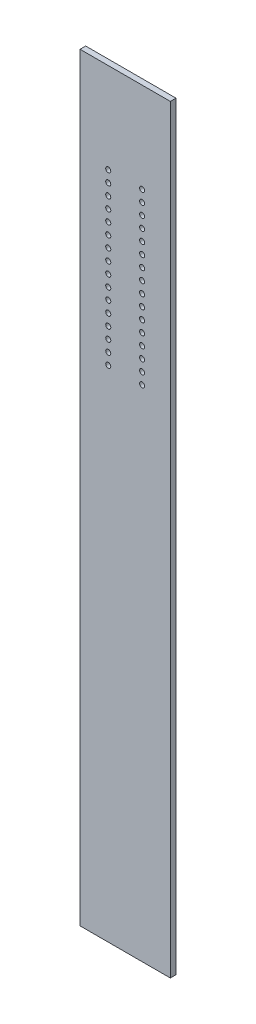
from build123d import *

# Parameters (mm, degrees)
SKETCH1_W           = 50.8
SKETCH1_H           = 3.175
BOSS_EXTRUDE1_DEPTH = 427.1518
SKETCH4_R           = 1.4224
CUT_EXTRUDE2_DEPTH  = 2.54
SKETCH5_W           = 12.58267919
SKETCH5_H           = 101.029760921
BOSS_EXTRUDE2_DEPTH = 2.54
SKETCH6_W           = 7.546607927
SKETCH6_H           = 108.671154153
SKETCH6_W_2         = 9.055929513
BOSS_EXTRUDE3_DEPTH = 2.54


with BuildPart() as part:
    # Sketch1 → Boss-Extrude1 (new body)
    with BuildSketch(Plane(origin=(0, 0, 0), x_dir=(1, 0, 0), z_dir=(0, 1, 0))):
        with Locations((0, 70.254548969)):
            Rectangle(SKETCH1_W, SKETCH1_H)
    extrude(amount=BOSS_EXTRUDE1_DEPTH)

    # Sketch4 → Cut-Extrude2 (cut)
    with BuildSketch(Plane.XY.offset(-68.667048969)):
        with Locations((-3.175, 376.3518)):
            Circle(SKETCH4_R)
        with Locations((-9.525, 376.3518)):
            Circle(SKETCH4_R)
        with Locations((-15.875, 376.3518)):
            Circle(SKETCH4_R)
        with Locations((-9.525, 370.0018)):
            Circle(SKETCH4_R)
        with Locations((-15.875, 370.0018)):
            Circle(SKETCH4_R)
        with Locations((-9.525, 363.6518)):
            Circle(SKETCH4_R)
        with Locations((-15.875, 363.6518)):
            Circle(SKETCH4_R)
        with Locations((-9.525, 357.3018)):
            Circle(SKETCH4_R)
        with Locations((-15.875, 357.3018)):
            Circle(SKETCH4_R)
        with Locations((-9.525, 350.9518)):
            Circle(SKETCH4_R)
        with Locations((-15.875, 350.9518)):
            Circle(SKETCH4_R)
        with Locations((-9.525, 344.6018)):
            Circle(SKETCH4_R)
        with Locations((-15.875, 344.6018)):
            Circle(SKETCH4_R)
        with Locations((-9.525, 338.2518)):
            Circle(SKETCH4_R)
        with Locations((-15.875, 338.2518)):
            Circle(SKETCH4_R)
        with Locations((-9.525, 331.9018)):
            Circle(SKETCH4_R)
        with Locations((-15.875, 331.9018)):
            Circle(SKETCH4_R)
        with Locations((-9.525, 325.5518)):
            Circle(SKETCH4_R)
        with Locations((-15.875, 325.5518)):
            Circle(SKETCH4_R)
        with Locations((-9.525, 319.2018)):
            Circle(SKETCH4_R)
        with Locations((-15.875, 319.2018)):
            Circle(SKETCH4_R)
        with Locations((-9.525, 312.8518)):
            Circle(SKETCH4_R)
        with Locations((-15.875, 312.8518)):
            Circle(SKETCH4_R)
        with Locations((-9.525, 306.5018)):
            Circle(SKETCH4_R)
        with Locations((-15.875, 306.5018)):
            Circle(SKETCH4_R)
        with Locations((-9.525, 300.1518)):
            Circle(SKETCH4_R)
        with Locations((-15.875, 300.1518)):
            Circle(SKETCH4_R)
        with Locations((-9.525, 293.8018)):
            Circle(SKETCH4_R)
        with Locations((-15.875, 293.8018)):
            Circle(SKETCH4_R)
        with Locations((-9.525, 287.4518)):
            Circle(SKETCH4_R)
        with Locations((-15.875, 287.4518)):
            Circle(SKETCH4_R)
        with Locations((-9.525, 281.1018)):
            Circle(SKETCH4_R)
        with Locations((-15.875, 281.1018)):
            Circle(SKETCH4_R)
        with Locations((-3.175, 370.0018)):
            Circle(SKETCH4_R)
        with Locations((-3.175, 363.6518)):
            Circle(SKETCH4_R)
        with Locations((-3.175, 357.3018)):
            Circle(SKETCH4_R)
        with Locations((-3.175, 350.9518)):
            Circle(SKETCH4_R)
        with Locations((-3.175, 344.6018)):
            Circle(SKETCH4_R)
        with Locations((-3.175, 338.2518)):
            Circle(SKETCH4_R)
        with Locations((-3.175, 331.9018)):
            Circle(SKETCH4_R)
        with Locations((-3.175, 325.5518)):
            Circle(SKETCH4_R)
        with Locations((-3.175, 319.2018)):
            Circle(SKETCH4_R)
        with Locations((-3.175, 312.8518)):
            Circle(SKETCH4_R)
        with Locations((-3.175, 306.5018)):
            Circle(SKETCH4_R)
        with Locations((-3.175, 300.1518)):
            Circle(SKETCH4_R)
        with Locations((-3.175, 293.8018)):
            Circle(SKETCH4_R)
        with Locations((-3.175, 287.4518)):
            Circle(SKETCH4_R)
        with Locations((-3.175, 281.1018)):
            Circle(SKETCH4_R)
        with Locations((3.175, 281.1018)):
            Circle(SKETCH4_R)
        with Locations((3.175, 287.4518)):
            Circle(SKETCH4_R)
        with Locations((3.175, 293.8018)):
            Circle(SKETCH4_R)
        with Locations((3.175, 300.1518)):
            Circle(SKETCH4_R)
        with Locations((3.175, 306.5018)):
            Circle(SKETCH4_R)
        with Locations((3.175, 312.8518)):
            Circle(SKETCH4_R)
        with Locations((3.175, 319.2018)):
            Circle(SKETCH4_R)
        with Locations((3.175, 325.5518)):
            Circle(SKETCH4_R)
        with Locations((3.175, 331.9018)):
            Circle(SKETCH4_R)
        with Locations((3.175, 338.2518)):
            Circle(SKETCH4_R)
        with Locations((3.175, 344.6018)):
            Circle(SKETCH4_R)
        with Locations((3.175, 350.9518)):
            Circle(SKETCH4_R)
        with Locations((3.175, 357.3018)):
            Circle(SKETCH4_R)
        with Locations((3.175, 363.6518)):
            Circle(SKETCH4_R)
        with Locations((3.175, 370.0018)):
            Circle(SKETCH4_R)
        with Locations((15.875, 281.1018)):
            Circle(SKETCH4_R)
        with Locations((9.525, 281.1018)):
            Circle(SKETCH4_R)
        with Locations((15.875, 287.4518)):
            Circle(SKETCH4_R)
        with Locations((9.525, 287.4518)):
            Circle(SKETCH4_R)
        with Locations((15.875, 293.8018)):
            Circle(SKETCH4_R)
        with Locations((9.525, 293.8018)):
            Circle(SKETCH4_R)
        with Locations((15.875, 300.1518)):
            Circle(SKETCH4_R)
        with Locations((9.525, 300.1518)):
            Circle(SKETCH4_R)
        with Locations((15.875, 306.5018)):
            Circle(SKETCH4_R)
        with Locations((9.525, 306.5018)):
            Circle(SKETCH4_R)
        with Locations((15.875, 312.8518)):
            Circle(SKETCH4_R)
        with Locations((9.525, 312.8518)):
            Circle(SKETCH4_R)
        with Locations((15.875, 319.2018)):
            Circle(SKETCH4_R)
        with Locations((9.525, 319.2018)):
            Circle(SKETCH4_R)
        with Locations((15.875, 325.5518)):
            Circle(SKETCH4_R)
        with Locations((9.525, 325.5518)):
            Circle(SKETCH4_R)
        with Locations((15.875, 331.9018)):
            Circle(SKETCH4_R)
        with Locations((9.525, 331.9018)):
            Circle(SKETCH4_R)
        with Locations((15.875, 338.2518)):
            Circle(SKETCH4_R)
        with Locations((9.525, 338.2518)):
            Circle(SKETCH4_R)
        with Locations((15.875, 344.6018)):
            Circle(SKETCH4_R)
        with Locations((9.525, 344.6018)):
            Circle(SKETCH4_R)
        with Locations((15.875, 350.9518)):
            Circle(SKETCH4_R)
        with Locations((9.525, 350.9518)):
            Circle(SKETCH4_R)
        with Locations((15.875, 357.3018)):
            Circle(SKETCH4_R)
        with Locations((9.525, 357.3018)):
            Circle(SKETCH4_R)
        with Locations((15.875, 363.6518)):
            Circle(SKETCH4_R)
        with Locations((9.525, 363.6518)):
            Circle(SKETCH4_R)
        with Locations((15.875, 370.0018)):
            Circle(SKETCH4_R)
        with Locations((9.525, 370.0018)):
            Circle(SKETCH4_R)
        with Locations((15.875, 376.3518)):
            Circle(SKETCH4_R)
        with Locations((9.525, 376.3518)):
            Circle(SKETCH4_R)
        with Locations((3.175, 376.3518)):
            Circle(SKETCH4_R)
    extrude(amount=-CUT_EXTRUDE2_DEPTH, mode=Mode.SUBTRACT)

    # Sketch5 → Boss-Extrude2 (add)
    with BuildSketch(Plane.XY.offset(-68.667048969)):
        with Locations((-0.175223229, 328.362881378)):
            Rectangle(SKETCH5_W, SKETCH5_H)
    extrude(amount=-BOSS_EXTRUDE2_DEPTH)

    # Sketch6 → Boss-Extrude3 (add)
    with BuildSketch(Plane.XY.offset(-68.667048969)):
        with Locations((-16.484092579, 326.705642943)):
            Rectangle(SKETCH6_W, SKETCH6_H)
        with Locations((16.9725359, 326.705642943)):
            Rectangle(SKETCH6_W_2, SKETCH6_H)
    extrude(amount=-BOSS_EXTRUDE3_DEPTH)


solid = part.part
